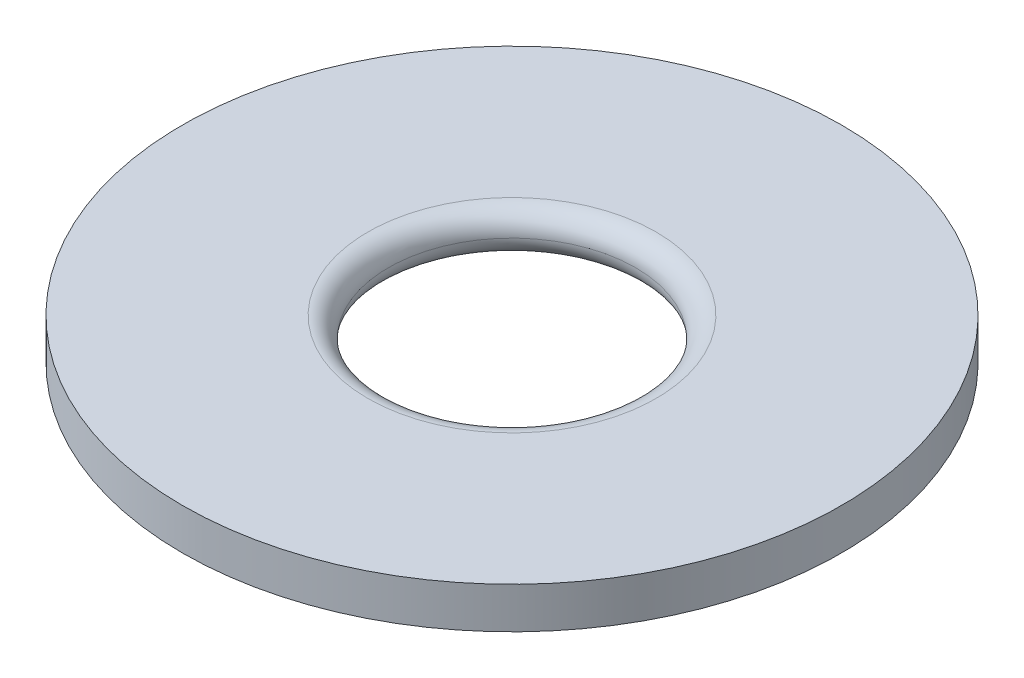
from build123d import *

# Parameters (mm, degrees)
SKETCH1_R           = 6.35
SKETCH1_R_2         = 2.38125
BOSS_EXTRUDE1_DEPTH = 0.79375
FILLET1_R           = 0.396875


with BuildPart() as part:
    # Sketch1 → Boss-Extrude1 (new body)
    with BuildSketch(Plane(origin=(0, 0, 0), x_dir=(1, 0, 0), z_dir=(0, 1, 0))):
        with Locations(Location((0, 0, 0), (0, 0, 270))):
            Circle(SKETCH1_R)
        with Locations(Location((0, 0, 0), (0, 0, 270))):
            Circle(SKETCH1_R_2, mode=Mode.SUBTRACT)
    extrude(amount=BOSS_EXTRUDE1_DEPTH)

    # Fillet1
    fillet1_edges = [part.edges().sort_by_distance(p)[0] for p in [
        (0, 0, -2.38125),
        (0, 0.79375, -2.38125),
    ]]
    fillet(fillet1_edges, radius=FILLET1_R - 0.0001)  # a hair under: the kernel refuses the full size


solid = part.part
